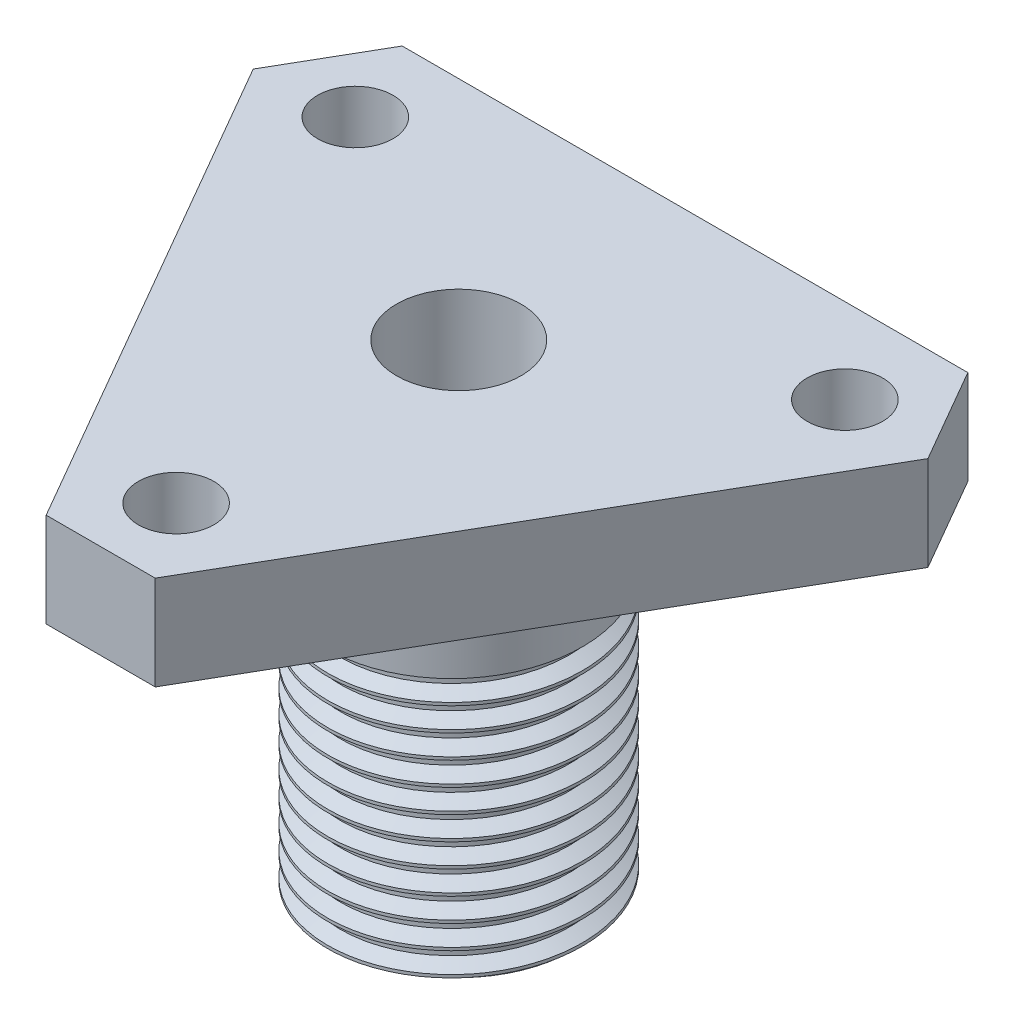
from build123d import *

# Parameters (mm, degrees)
FILETAGE1_PITCH              = 1.25
BOSS_EXTRU_1_START           = 20
BOSS_EXTRU_1_DEPTH           = 5
ENL_V_MAT_EXTRU_3_DEPTH      = 37.135427843
ENL_V_MAT_EXTRU_3_DEPTH_BACK = 37.135427843
ESQUISSE3_R                  = 3.3
ESQUISSE3_R_2                = 2


with BuildPart() as part:
    # Esquisse1 → Révolution1 (revolve)
    with BuildSketch(Plane.XY, mode=Mode.PRIVATE) as r_volution1_sk:
        Polygon((0, 0), (0, 20), (5.25, 20), (6.75, 20), (6.75, 0), (5.25, 0), align=None)
    revolve(r_volution1_sk.sketch.rotate(Axis((0, 0, 0), (0, 1, 0)), 90), axis=Axis((0, 0, 0), (0, 1, 0)))

    # Filetage1: the profile of Profil de filetage1 profile screwed along a right-hand helix of 17.6 turns, 8 arcs to a turn; built about Z, then put on its axis
    filetage1_z = Axis((0, 0, 0), (0, 0, 1))
    filetage1_corners = [(6.7503, 0, -0.000173205), (6.7503, 0, 1.093923202), (6.073417656, 0, 0.703124998), (6.073417656, 0, 0.390624998)]
    with BuildLine(mode=Mode.PRIVATE) as filetage1_profile:
        Line(filetage1_corners[0], filetage1_corners[1])
        Line(filetage1_corners[1], filetage1_corners[2])
        Line(filetage1_corners[2], filetage1_corners[3])
        Line(filetage1_corners[3], filetage1_corners[0])
    filetage1_cap = Face(filetage1_profile.wire())
    filetage1_turn_angles = [0, 22.5, 45, 67.5, 90, 112.5, 135, 157.5, 180, 202.5, 225, 247.5, 270, 292.5, 315, 337.5, 360]
    filetage1_turn_weights = [1, 0.9238795325112867, 1, 0.9238795325112867, 1, 0.9238795325112867, 1, 0.9238795325112867, 1, 0.9238795325112867, 1, 0.9238795325112867, 1, 0.9238795325112867, 1, 0.9238795325112867, 1]
    filetage1_turn_rails = [Edge.make_bspline([Vector(p[0], p[1], 0).rotate(filetage1_z, filetage1_turn_angles[k]) / filetage1_turn_weights[k] + Vector(0, 0, p[2] + FILETAGE1_PITCH * filetage1_turn_angles[k] / 360) for k in range(17)], [0, 0, 0, 1, 1, 2, 2, 3, 3, 4, 4, 5, 5, 6, 6, 7, 7, 8, 8, 8], 2, filetage1_turn_weights) for p in filetage1_corners]
    filetage1_turn_sides = [Face.make_surface_from_curves(filetage1_turn_rails[p[0]], filetage1_turn_rails[p[1]]) for p in [(0, 1), (1, 2), (2, 3), (3, 0)]]
    filetage1_last_angles = [6120, 6142.5, 6165, 6187.5, 6210, 6232.5, 6255, 6277.5, 6300, 6318, 6336]
    filetage1_last_weights = [1, 0.9238795325112867, 1, 0.9238795325112867, 1, 0.9238795325112867, 1, 0.9238795325112867, 1, 0.9510565162951535, 1]
    filetage1_last_rails = [Edge.make_bspline([Vector(p[0], p[1], 0).rotate(filetage1_z, filetage1_last_angles[k]) / filetage1_last_weights[k] + Vector(0, 0, p[2] + FILETAGE1_PITCH * filetage1_last_angles[k] / 360) for k in range(11)], [0, 0, 0, 1, 1, 2, 2, 3, 3, 4, 4, 5, 5, 5], 2, filetage1_last_weights) for p in filetage1_corners]
    filetage1_last_sides = [Face.make_surface_from_curves(filetage1_last_rails[p[0]], filetage1_last_rails[p[1]]) for p in [(0, 1), (1, 2), (2, 3), (3, 0)]]
    filetage1 = Plane(origin=(0, 15, 0), x_dir=(-1, 0, 0), z_dir=(0, -1, 0)) * Solid(Shell([*[p.moved(Location((0, 0, FILETAGE1_PITCH * i))) for i in range(17) for p in filetage1_turn_sides], *filetage1_last_sides, filetage1_cap, filetage1_cap.rotate(filetage1_z, 6336).moved(Location((0, 0, FILETAGE1_PITCH * 6336 / 360)))]))
    add(filetage1, mode=Mode.SUBTRACT)

    # Esquisse2 → Boss.-Extru.1 (add)
    with BuildSketch(Plane(origin=(0, 0, 0), x_dir=(1, 0, 0), z_dir=(0, 1, 0)).offset(BOSS_EXTRU_1_START)):
        Polygon((15, 12), (-15, 12), (-17.892304845, 6.990381057), (-2.892304845, -18.990381057), (2.892304845, -18.990381057), (17.892304845, 6.990381057), align=None)
    extrude(amount=BOSS_EXTRU_1_DEPTH)

    # Esquisse3 → Enlèv. mat.-Extru.3 (cut, two sides: drawn at the far end of the back side and taken through both)
    with BuildSketch(Plane(origin=(0, 0, 0), x_dir=(1, 0, 0), z_dir=(0, 1, 0)).offset(-ENL_V_MAT_EXTRU_3_DEPTH_BACK)):
        with Locations(Location((0, 0, 0), (0, 0, 270))):
            Circle(ESQUISSE3_R)
        with Locations(Location((-12.982050808, 7.495190528, 0), (0, 0, 270))):
            Circle(ESQUISSE3_R_2)
        with Locations(Location((12.982050808, 7.495190528, 0), (0, 0, 270))):
            Circle(ESQUISSE3_R_2)
        with Locations(Location((0, -14.990381057, 0), (0, 0, 270))):
            Circle(ESQUISSE3_R_2)
    extrude(amount=ENL_V_MAT_EXTRU_3_DEPTH + ENL_V_MAT_EXTRU_3_DEPTH_BACK, mode=Mode.SUBTRACT)


solid = part.part
